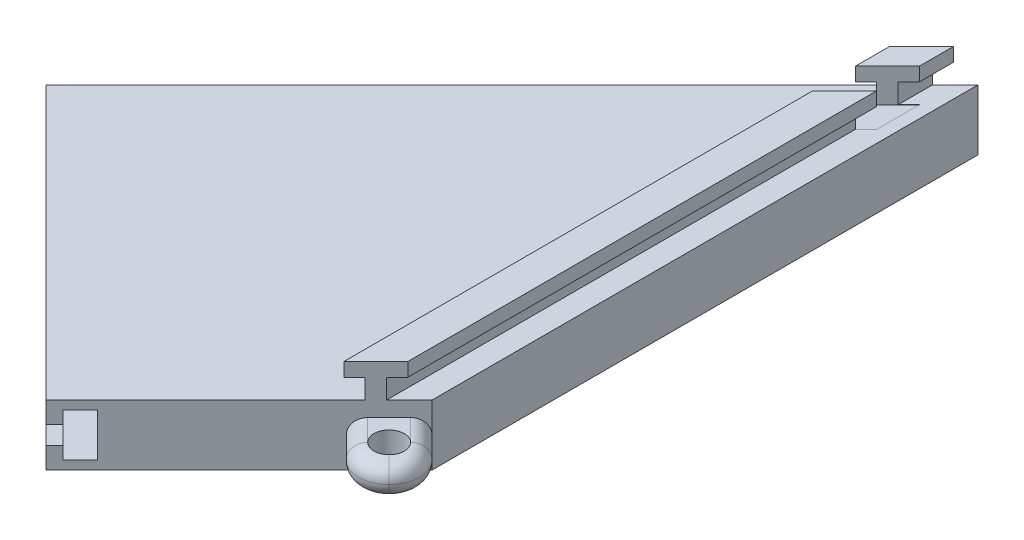
from build123d import *

# Parameters (mm, degrees)
BOSS_EXTRUDE1_DEPTH = 10
BOSS_EXTRUDE2_DEPTH = 5.5
BOSS_EXTRUDE4_DEPTH = 2.25
SKETCH5_W           = 167.071716414
SKETCH5_H           = 54.025930679
CUT_EXTRUDE1_DEPTH  = 100
BOSS_EXTRUDE5_DEPTH = 5.5
BOSS_EXTRUDE6_DEPTH = 2.25
CUT_EXTRUDE2_DEPTH  = 2.25
CUT_EXTRUDE3_DEPTH  = 5.5
CUT_EXTRUDE4_DEPTH  = 5.5
CUT_EXTRUDE5_DEPTH  = 5.5
CUT_EXTRUDE6_DEPTH  = 5.5
SKETCH14_W          = 63.639610307
SKETCH14_H          = 3
CUT_EXTRUDE7_DEPTH  = 6
SKETCH15_W          = 4
SKETCH15_H          = 7.1
CUT_EXTRUDE8_DEPTH  = 150
SKETCH16_W          = 18.586901627
SKETCH16_H          = 5.5
CUT_EXTRUDE9_DEPTH  = 34
SKETCH17_W          = 2.5
SKETCH17_H          = 5.5
CUT_EXTRUDE10_DEPTH = 34
SKETCH18_W          = 1.498020702
SKETCH18_H          = 5.5
CUT_EXTRUDE11_DEPTH = 34
SKETCH19_W          = 3.248020701
SKETCH19_H          = 2.25
CUT_EXTRUDE12_DEPTH = 34
BOSS_EXTRUDE7_DEPTH = 10
SKETCH21_R          = 2.5
CUT_EXTRUDE13_DEPTH = 10
FILLET1_R           = 5
FILLET2_R           = 5
CUT_EXTRUDE14_DEPTH = 2.5
CUT_EXTRUDE15_DEPTH = 2.5
FILLET6_R           = 2.5
FILLET7_R           = 2.5
CUT_EXTRUDE16_DEPTH = 10
CUT_EXTRUDE17_DEPTH = 5.535550905
SKETCH26_W          = 38.089982304
SKETCH26_H          = 10
BOSS_EXTRUDE8_DEPTH = 50


with BuildPart() as part:
    # Sketch1 → Boss-Extrude1 (new body)
    with BuildSketch(Plane(origin=(0, 0, 0), x_dir=(1, 0, 0), z_dir=(0, 1, 0))):
        Polygon((0, 0), (0, -90), (-63.639610307, -153.639610307), (-153.639610307, -153.639610307), align=None)
    extrude(amount=BOSS_EXTRUDE1_DEPTH)

    # Sketch3 → Boss-Extrude2 (add)
    with BuildSketch(Plane(origin=(0, 10, 0), x_dir=(1, 0, 0), z_dir=(0, 1, 0))):
        Polygon((-3.75, -3.75), (-3.75, -93.75), (-5.517766953, -95.517766953), (-5.517766953, -5.517766953), align=None)
    extrude(amount=BOSS_EXTRUDE2_DEPTH)

    # Sketch4 → Boss-Extrude4 (add)
    with BuildSketch(Plane(origin=(0, 15.5, 0), x_dir=(1, 0, 0), z_dir=(0, 1, 0))):
        Polygon((-3.75, -93.75), (-2, -92), (-2, -2), (-7.267766953, -7.267766953), (-7.267766953, -97.267766953), align=None)
    extrude(amount=-BOSS_EXTRUDE4_DEPTH)

    # Sketch5 → Cut-Extrude1 (cut)
    with BuildSketch(Plane(origin=(45, 0, 45), x_dir=(0.7071067811865487, 0, -0.7071067811865464), z_dir=(0.7071067811865464, 0, 0.7071067811865487))):
        with Locations((-192.175468514, 27.01296534)):
            Rectangle(SKETCH5_W, SKETCH5_H)
    extrude(amount=-CUT_EXTRUDE1_DEPTH, mode=Mode.SUBTRACT)

    # Sketch6 → Boss-Extrude5 (add)
    with BuildSketch(Plane(origin=(0, 10, 0), x_dir=(1, 0, 0), z_dir=(0, 1, 0))):
        Polygon((-7.267766953, -97.267766953), (-27.267766953, -97.267766953), (-41.819805153, -111.819805153), (-43.587572106, -110.0520382), (-28.303300859, -94.767766953), (-7.267766953, -94.767766953), align=None)
    extrude(amount=BOSS_EXTRUDE5_DEPTH)

    # Sketch7 → Boss-Extrude6 (add)
    with BuildSketch(Plane(origin=(0, 15.5, 0), x_dir=(1, 0, 0), z_dir=(0, 1, 0))):
        Polygon((-7.267766953, -94.767766953), (-7.267766953, -93.017766953), (-29.028174593, -93.017766953), (-44.822087786, -108.811680146), (-40.579447099, -113.054320833), (-26.542893219, -99.017766953), (-7.267766953, -99.017766953), align=None)
    extrude(amount=-BOSS_EXTRUDE6_DEPTH)

    # Sketch8 → Cut-Extrude2 (cut)
    with BuildSketch(Plane(origin=(0, 15.5, 0), x_dir=(1, 0, 0), z_dir=(0, 1, 0))):
        Polygon((-7.267766953, -97.267766953), (-9.017766953, -99.017766953), (-6.756511784, -101.279022122), (-4.757663026, -99.017766953), align=None)
    extrude(amount=-CUT_EXTRUDE2_DEPTH, mode=Mode.SUBTRACT)

    # Sketch9 → Cut-Extrude3 (cut)
    with BuildSketch(Plane(origin=(0, 15.5, 0), x_dir=(1, 0, 0), z_dir=(0, 1, 0))):
        Polygon((-29.028174593, -93.017766953), (-26.542893219, -99.017766953), (-24.410661726, -99.017766953), (-18.410661726, -93.017766953), align=None)
    extrude(amount=-CUT_EXTRUDE3_DEPTH, mode=Mode.SUBTRACT)

    # Sketch10 → Cut-Extrude4 (cut)
    with BuildSketch(Plane(origin=(0, 15.5, 0), x_dir=(1, 0, 0), z_dir=(0, 1, 0))):
        Polygon((-26.542893219, -99.017766953), (-28.439849815, -100.914723549), (-36.92513119, -100.914723549), (-29.028174593, -93.017766953), align=None)
    extrude(amount=-CUT_EXTRUDE4_DEPTH, mode=Mode.SUBTRACT)

    # Sketch11 → Cut-Extrude5 (cut)
    with BuildSketch(Plane(origin=(0, 15.5, 0), x_dir=(1, 0, 0), z_dir=(0, 1, 0))):
        Polygon((-23.159902577, -99.017766953), (-17.159902577, -93.017766953), (-18.410661726, -93.017766953), (-24.410661726, -99.017766953), align=None)
    extrude(amount=-CUT_EXTRUDE5_DEPTH, mode=Mode.SUBTRACT)

    # Sketch13 → Cut-Extrude6 (cut)
    with BuildSketch(Plane(origin=(0, 15.5, 0), x_dir=(1, 0, 0), z_dir=(0, 1, 0))):
        Polygon((-7.267766953, -93.017766953), (-7.267766953, -97.267766953), (-7.267766953, -100.891740466), (-9.284719157, -100.891740466), (-9.284719157, -93.017766953), align=None)
    extrude(amount=-CUT_EXTRUDE6_DEPTH, mode=Mode.SUBTRACT)

    # Sketch14 → Cut-Extrude7 (cut)
    with BuildSketch(Plane(origin=(-76.819805153, 0, 76.819805153), x_dir=(0.7071067811865465, 0, 0.7071067811865487), z_dir=(-0.7071067811865487, 0, 0.7071067811865465))):
        with Locations((31.819805154, 5)):
            Rectangle(SKETCH14_W, SKETCH14_H)
    extrude(amount=-CUT_EXTRUDE7_DEPTH, mode=Mode.SUBTRACT)

    # Sketch15 → Cut-Extrude8 (cut)
    with BuildSketch(Plane(origin=(0, 0, 0), x_dir=(-0.7071067811865434, 0, 0.7071067811865517), z_dir=(-0.7071067811865517, 0, -0.7071067811865434))):
        with Locations((104.639610307, 5)):
            Rectangle(SKETCH15_W, SKETCH15_H)
    extrude(amount=-CUT_EXTRUDE8_DEPTH, mode=Mode.SUBTRACT)

    # Sketch16 → Cut-Extrude9 (cut)
    with BuildSketch(Plane(origin=(-76.816883966, 0, 76.816883966), x_dir=(0.7071067811865475, 0, 0.7071067811865477), z_dir=(-0.7071067811865477, 0, 0.7071067811865475))):
        with Locations((54.540925497, 12.75)):
            Rectangle(SKETCH16_W, SKETCH16_H)
    extrude(amount=-CUT_EXTRUDE9_DEPTH, mode=Mode.SUBTRACT)

    # Sketch17 → Cut-Extrude10 (cut)
    with BuildSketch(Plane(origin=(-76.819805153, 0, 76.819805153), x_dir=(0.7071067811865465, 0, 0.7071067811865487), z_dir=(-0.7071067811865487, 0, 0.7071067811865465))):
        with Locations((48.247474683, 12.75)):
            Rectangle(SKETCH17_W, SKETCH17_H)
    extrude(amount=-CUT_EXTRUDE10_DEPTH, mode=Mode.SUBTRACT)

    # Sketch18 → Cut-Extrude11 (cut)
    with BuildSketch(Plane(origin=(-9.284719157, 0, 0), x_dir=(0, 0, -1), z_dir=(1, 0, 0))):
        with Locations((-95.516777304, 12.75)):
            Rectangle(SKETCH18_W, SKETCH18_H)
    extrude(amount=-CUT_EXTRUDE11_DEPTH, mode=Mode.SUBTRACT)


with BuildPart() as cut_extrude11_piece_1:
    # of the separate pieces the step leaves, piece 1, a body of its own (cut_extrude11_pieces)
    add(part.part.solids().sort_by_distance((0, 0, 0))[0])

    # Sketch20 → Boss-Extrude7 (add)
    with BuildSketch(Plane(origin=(0, 10, 0), x_dir=(1, 0, 0), z_dir=(0, 1, 0))):
        Polygon((0, -90), (-7.071067812, -97.071067812), (0, -104.142135624), (7.071067812, -97.071067812), align=None)
    extrude(amount=-BOSS_EXTRUDE7_DEPTH)

    # Sketch21 → Cut-Extrude13 (cut)
    with BuildSketch(Plane(origin=(0, 10, 0), x_dir=(1, 0, 0), z_dir=(0, 1, 0))):
        with Locations(Location((0, -97.071067812, 0), (0, 0, 270))):
            Circle(SKETCH21_R)
    extrude(amount=-CUT_EXTRUDE13_DEPTH, mode=Mode.SUBTRACT)

    # Fillet1
    fillet1_edges = [cut_extrude11_piece_1.edges().sort_by_distance(p)[0] for p in [
        (7.071067812, 5, 97.071067812),
    ]]
    fillet(fillet1_edges, radius=FILLET1_R)

    # Fillet2
    fillet2_edges = [cut_extrude11_piece_1.edges().sort_by_distance(p)[0] for p in [
        (0, 5, 104.142135624),
    ]]
    fillet(fillet2_edges, radius=FILLET2_R - 0.0001)  # a hair under: the kernel refuses the full size

    # Sketch22 → Cut-Extrude14 (cut)
    with BuildSketch(Plane(origin=(0, 10, 0), x_dir=(1, 0, 0), z_dir=(0, 1, 0))):
        Polygon((0, -90), (-7.071067812, -97.071067812), (5.303300859, -109.445436483), (12.374368671, -102.374368671), align=None)
    extrude(amount=-CUT_EXTRUDE14_DEPTH, mode=Mode.SUBTRACT)

    # Sketch23 → Cut-Extrude15 (cut)
    with BuildSketch(Plane(origin=(0, 0, 0), x_dir=(-1, 0, 0), z_dir=(0, -1, 0))):
        Polygon((0, -90), (7.071067812, -97.071067812), (-2.948055245, -107.090190869), (-10.019123057, -100.019123057), align=None)
    extrude(amount=-CUT_EXTRUDE15_DEPTH, mode=Mode.SUBTRACT)

    # Fillet6
    fillet6_edges = [cut_extrude11_piece_1.edges().sort_by_distance(p)[0] for p in [
        (-5.303265504, 7.5, 98.83887012),
        (1.767766953, 7.5, 91.767766953),
        (0, 7.5, 102.071109233),
    ]]
    fillet(fillet6_edges, radius=FILLET6_R - 0.0001)  # a hair under: the kernel refuses the full size

    # Fillet7
    fillet7_edges = [cut_extrude11_piece_1.edges().sort_by_distance(p)[0] for p in [
        (1.767766953, 2.5, 91.767766953),
        (-5.303265504, 2.5, 98.83887012),
        (0, 2.5, 102.071109233),
    ]]
    fillet(fillet7_edges, radius=FILLET7_R - 0.0001)  # a hair under: the kernel refuses the full size

    # Sketch24 → Cut-Extrude16 (cut)
    with BuildSketch(Plane(origin=(0, 10, 0), x_dir=(1, 0, 0), z_dir=(0, 1, 0))):
        with BuildLine():
            Line((-24.973066028, -85.839611094), (-10.945777457, -85.839611094))
            ThreePointArc((-10.945777457, -85.839611094), (-8.23469039, -83.128524027), (-10.945777457, -80.417436961))
            Line((-10.945777457, -80.417436961), (-25.516199237, -80.417436961))
            ThreePointArc((-25.516199237, -80.417436961), (-23.520394737, -82.394976475), (-24.243415571, -85.109960637))
            Line((-24.243415571, -85.109960637), (-24.973066028, -85.839611094))
        make_face()
        with BuildLine():
            Line((-38.387291027, -99.253836092), (-24.973066028, -85.839611094))
            Line((-24.973066028, -85.839611094), (-26.224852181, -85.839611094))
            ThreePointArc((-26.224852181, -85.839611094), (-28.935939248, -83.128524027), (-26.224852181, -80.417436961))
            Line((-26.224852181, -80.417436961), (-25.516199237, -80.417436961))
            ThreePointArc((-25.516199237, -80.417436961), (-26.958399734, -80.424066583), (-28.206288791, -81.147087417))
            Line((-28.206288791, -81.147087417), (-42.350164246, -95.290962873))
            ThreePointArc((-42.350164246, -95.290962873), (-42.350164246, -99.253836092), (-38.387291027, -99.253836092))
        make_face()
        with BuildLine():
            Line((-26.224852181, -85.839611094), (-24.973066028, -85.839611094))
            Line((-24.973066028, -85.839611094), (-24.243415571, -85.109960637))
            ThreePointArc((-24.243415571, -85.109960637), (-23.520394737, -82.394976475), (-25.516199237, -80.417436961))
            Line((-25.516199237, -80.417436961), (-26.224852181, -80.417436961))
            ThreePointArc((-26.224852181, -80.417436961), (-28.935939248, -83.128524027), (-26.224852181, -85.839611094))
        make_face()
    extrude(amount=-CUT_EXTRUDE16_DEPTH, mode=Mode.SUBTRACT)

    # Sketch25 → Cut-Extrude17 (cut)
    with BuildSketch(Plane(origin=(0, 15.5, 0), x_dir=(1, 0, 0), z_dir=(0, 1, 0))):
        Polygon((-2, -7.656854249), (-7.267766953, -12.924621202), (-7.267766953, -19.995689014), (-2, -14.727922061), align=None)
    extrude(amount=-CUT_EXTRUDE17_DEPTH, mode=Mode.SUBTRACT)

    # Sketch26 → Boss-Extrude8 (add)
    with BuildSketch(Plane(origin=(45, 0, 45), x_dir=(0.7071067811865487, 0, -0.7071067811865464), z_dir=(0.7071067811865464, 0, 0.7071067811865487))):
        with Locations((-82.684601459, 5)):
            Rectangle(SKETCH26_W, SKETCH26_H)
    extrude(amount=-BOSS_EXTRUDE8_DEPTH)


with BuildPart() as cut_extrude11_piece_2:
    # of the separate pieces the step leaves, piece 2, a body of its own (cut_extrude11_pieces)
    add(part.part.solids().sort_by_distance((-10.782739858, 13.25, 94.767766953))[0])

    # Sketch19 → Cut-Extrude12 (cut)
    with BuildSketch(Plane(origin=(0, 0, 93.017766953), x_dir=(-1, 0, 0), z_dir=(0, 0, -1))):
        with Locations((10.908729508, 14.375)):
            Rectangle(SKETCH19_W, SKETCH19_H)
    extrude(amount=-CUT_EXTRUDE12_DEPTH, mode=Mode.SUBTRACT)


solid = cut_extrude11_piece_1.part
